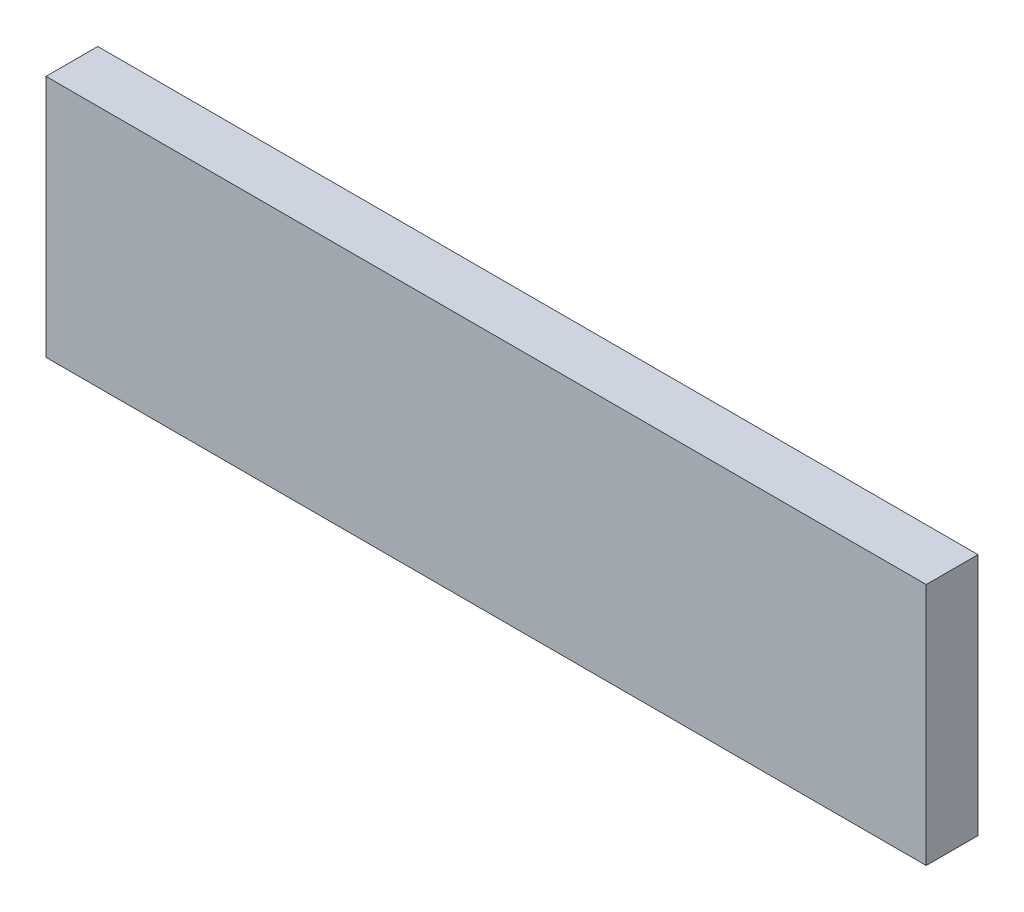
from build123d import *

# Parameters (mm, degrees)
SKETCH1_W           = 170
SKETCH1_H           = 47
BOSS_EXTRUDE1_DEPTH = 10


with BuildPart() as part:
    # Sketch1 → Boss-Extrude1 (new body)
    with BuildSketch(Plane.XY):
        with Locations((85, 23.5)):
            Rectangle(SKETCH1_W, SKETCH1_H)
    extrude(amount=BOSS_EXTRUDE1_DEPTH)


solid = part.part
